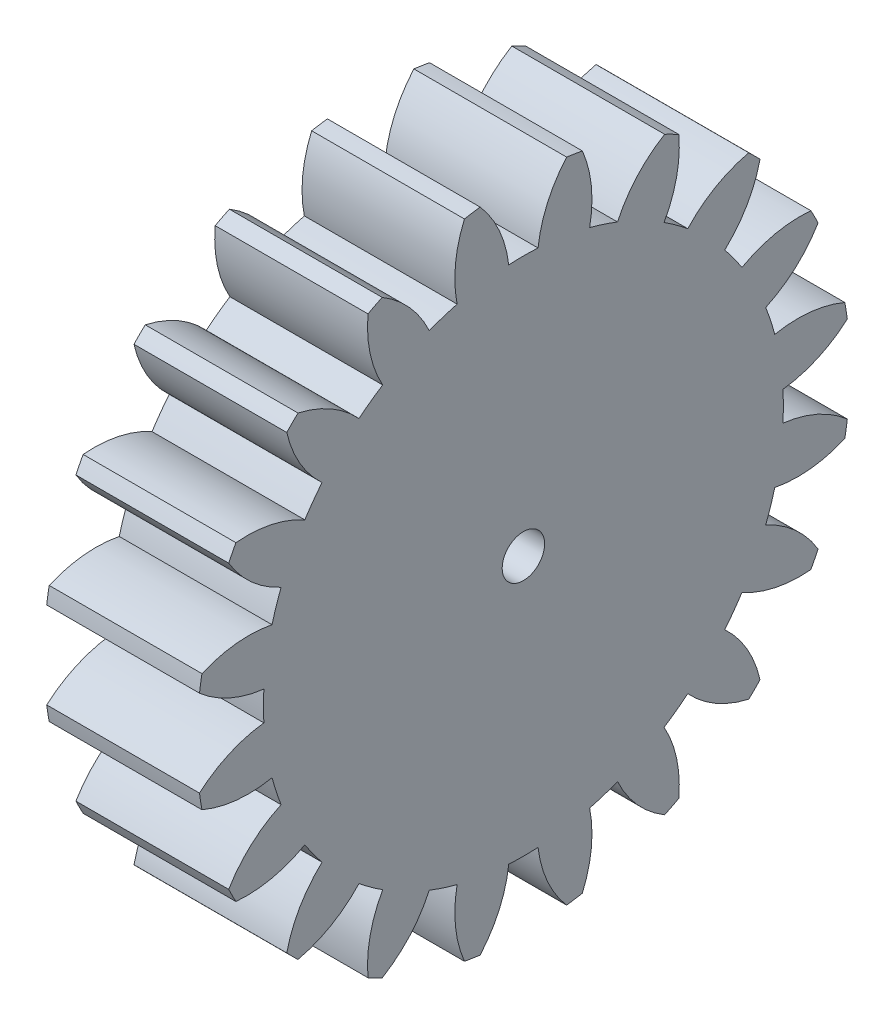
from build123d import *

# Parameters (mm, degrees)
BASPROSKE_W     = 18
BASPROSKE_H     = 38.5
TOOTHCUT_DEPTH  = 58.345444457
TEETHCUTS_COUNT = 20
TEETHCUTS_ANGLE = 342
BORSKE_R        = 2.5
BORE_DEPTH      = 50.0000508


with BuildPart() as part:
    # BasProSke → Base-Revolve (revolve)
    with BuildSketch(Plane(origin=(0, 0, 0), x_dir=(1, 0, 0), z_dir=(0, 1, 0))):
        with Locations((9, 19.25)):
            Rectangle(BASPROSKE_W, BASPROSKE_H)
    revolve(axis=Axis((-10, 0, 0), (1, 0, 0)))

    # TooCutSke → ToothCut (cut, through all)
    with BuildSketch(Plane(origin=(0, 0, 0), x_dir=(0, 0, -1), z_dir=(1, 0, 0))):
        with BuildLine():
            ThreePointArc((1.725504935, 30.575349691), (0, 30.624), (-1.725504935, 30.575349691))
            ThreePointArc((-1.725504935, 30.575349691), (-2.842155064, 34.637801182), (-5.116866355, 38.184082075))
            ThreePointArc((-5.116866355, 38.184082075), (0, 38.5254), (5.116866355, 38.184082075))
            ThreePointArc((5.116866355, 38.184082075), (2.842155064, 34.637801182), (1.725504935, 30.575349691))
        make_face()
    toothcut = extrude(amount=TOOTHCUT_DEPTH, mode=Mode.SUBTRACT)

    # TeethCuts: ToothCut ×20 about axis
    teethcuts_axis = Axis((-10, 0, 0), (1, 0, 0))
    for i in range(1, TEETHCUTS_COUNT):
        add(toothcut.rotate(teethcuts_axis, i * TEETHCUTS_ANGLE / (TEETHCUTS_COUNT - 1)), mode=Mode.SUBTRACT)

    # BorSke → Bore (cut, symmetric)
    with BuildSketch(Plane(origin=(0, 0, 0), x_dir=(0, 0, -1), z_dir=(1, 0, 0))):
        Circle(BORSKE_R)
    extrude(amount=BORE_DEPTH, both=True, mode=Mode.SUBTRACT)


solid = part.part
